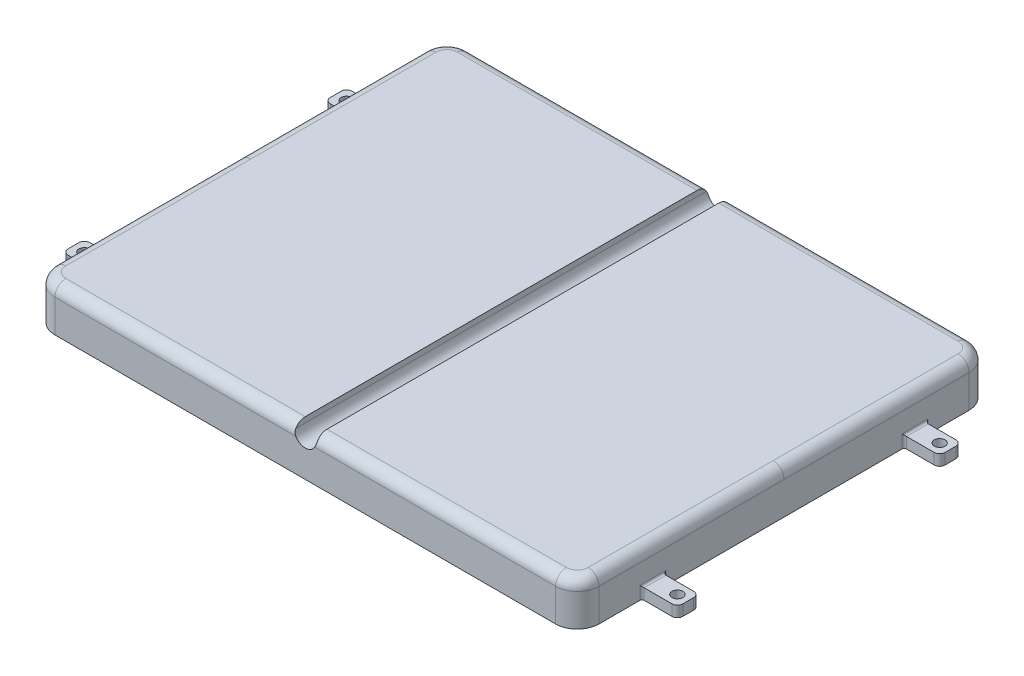
from build123d import *

# Parameters (mm, degrees)
BOSS_EXTRUDE1_DEPTH  = 10.16
SKETCH3_R            = 1.27
CUT_EXTRUDE1_DEPTH   = 10.16
SKETCH4_W            = 8.255
SKETCH4_H            = 7.62
CUT_EXTRUDE2_DEPTH   = 10.16
CUT_EXTRUDE3_DEPTH   = 69.596
FILLET1_R            = 2.54
FILLET2_R            = 0.508
FILLET3_R            = 1.27
FILLET1_OF_MIRROR3_R = 2.54
FILLET2_OF_MIRROR3_R = 0.508
FILLET3_OF_MIRROR3_R = 1.27


# Read off the part's stored shape, not the designer's step: Mirror4
with BuildPart() as part:
    # Sketch1 → Boss-Extrude1 (new body)
    with BuildSketch(Plane(origin=(0, 0, 0), x_dir=(1, 0, 0), z_dir=(0, 1, 0))):
        with BuildLine():
            Line((-58.188733064, -33.517116066), (5.311266936, -33.517116066))
            Line((5.311266936, -33.517116066), (5.311266936, 14.742883934))
            Line((5.311266936, 14.742883934), (-53.108733064, 14.742883934))
            ThreePointArc((-53.108733064, 14.742883934), (-56.700835512, 13.254986382), (-58.188733064, 9.662883934))
            Line((-58.188733064, 9.662883934), (-58.188733064, -0.370116066))
            Line((-58.188733064, -0.370116066), (-66.443733064, -0.370116066))
            Line((-66.443733064, -0.370116066), (-66.443733064, -5.450116066))
            Line((-66.443733064, -5.450116066), (-58.188733064, -5.450116066))
            Line((-58.188733064, -5.450116066), (-58.188733064, -33.517116066))
        make_face()
    boss_extrude1 = extrude(amount=BOSS_EXTRUDE1_DEPTH)

    # Sketch3 → Cut-Extrude1 (cut)
    with BuildSketch(Plane(origin=(0, 10.16, 0), x_dir=(1, 0, 0), z_dir=(0, 1, 0))):
        with Locations(Location((-63.903733064, -2.910116066, 0), (0, 0, 270))):
            Circle(SKETCH3_R)
    cut_extrude1 = extrude(amount=-CUT_EXTRUDE1_DEPTH, mode=Mode.SUBTRACT)

    # Sketch4 → Cut-Extrude2 (cut)
    with BuildSketch(Plane.XY.offset(5.450116066)):
        with Locations((-62.316233064, 6.35)):
            Rectangle(SKETCH4_W, SKETCH4_H)
    cut_extrude2 = extrude(amount=-CUT_EXTRUDE2_DEPTH, mode=Mode.SUBTRACT)

    # Sketch5 → Cut-Extrude3 (cut)
    with BuildSketch(Plane.XY.offset(33.517116066)):
        with BuildLine():
            Line((5.311266936, 10.16), (5.311266936, 8.89))
            Line((5.311266936, 8.89), (5.311266936, 6.35))
            ThreePointArc((5.311266936, 6.35), (3.515215712, 7.093948776), (2.771266936, 8.89))
            Line((2.771266936, 8.89), (2.771266936, 10.16))
            Line((2.771266936, 10.16), (5.311266936, 10.16))
        make_face()
    cut_extrude3 = extrude(amount=-CUT_EXTRUDE3_DEPTH, mode=Mode.SUBTRACT)

    # Fillet1
    fillet1_edges = [part.edges().sort_by_distance(p)[0] for p in [
        (-25.168733064, 10.16, -14.742883934),
        (-56.700835512, 10.16, -13.254986382),
        (-58.188733064, 10.16, 11.927116066),
    ]]
    fillet(fillet1_edges, radius=FILLET1_R)

    # Fillet2
    fillet2_edges = [part.edges().sort_by_distance(p)[0] for p in [
        (-58.188733064, 1.27, 5.450116066),
        (-58.188733064, 1.27, 0.370116066),
        (-58.188733064, 2.54, 2.910116066),
    ]]
    fillet(fillet2_edges, radius=FILLET2_R)

    # Fillet3
    fillet3_edges = [part.edges().sort_by_distance(p)[0] for p in [
        (-66.443733064, 1.27, 5.450116066),
        (-66.443733064, 1.27, 0.370116066),
    ]]
    fillet(fillet3_edges, radius=FILLET3_R)

    # Mirror3: Boss-Extrude1, Cut-Extrude1, Cut-Extrude2, Cut-Extrude3 across plane
    add(boss_extrude1.mirror(Plane(origin=(-58.188733064, 10.16, 33.517116066), x_dir=(1, 0, 0), z_dir=(0, 0, -1))))
    add(cut_extrude1.mirror(Plane(origin=(-58.188733064, 10.16, 33.517116066), x_dir=(1, 0, 0), z_dir=(0, 0, -1))), mode=Mode.SUBTRACT)
    add(cut_extrude2.mirror(Plane(origin=(-58.188733064, 10.16, 33.517116066), x_dir=(1, 0, 0), z_dir=(0, 0, -1))), mode=Mode.SUBTRACT)
    add(cut_extrude3.mirror(Plane(origin=(-58.188733064, 10.16, 33.517116066), x_dir=(1, 0, 0), z_dir=(0, 0, -1))), mode=Mode.SUBTRACT)

    # Fillet1 of Mirror3
    fillet1_of_mirror3_edges = [part.edges().sort_by_distance(p)[0] for p in [
        (-25.168733064, 10.16, 81.777116066),
        (-56.700835512, 10.16, 80.289218515),
        (-58.188733064, 10.16, 55.107116066),
    ]]
    fillet(fillet1_of_mirror3_edges, radius=FILLET1_OF_MIRROR3_R)

    # Fillet2 of Mirror3
    fillet2_of_mirror3_edges = [part.edges().sort_by_distance(p)[0] for p in [
        (-58.188733064, 1.27, 61.584116066),
        (-58.188733064, 1.27, 66.664116066),
        (-58.188733064, 2.54, 64.124116066),
    ]]
    fillet(fillet2_of_mirror3_edges, radius=FILLET2_OF_MIRROR3_R)

    # Fillet3 of Mirror3
    fillet3_of_mirror3_edges = [part.edges().sort_by_distance(p)[0] for p in [
        (-66.443733064, 1.27, 61.584116066),
        (-66.443733064, 1.27, 66.664116066),
    ]]
    fillet(fillet3_of_mirror3_edges, radius=FILLET3_OF_MIRROR3_R)

    # Mirror4: part across plane


with BuildPart() as part_1:
    add(part.part)
    add(part.part.mirror(Plane(origin=(5.311266936, 10.16, -14.742883934), x_dir=(0, 0, 1), z_dir=(-1, 0, 0))))


solid = part_1.part
